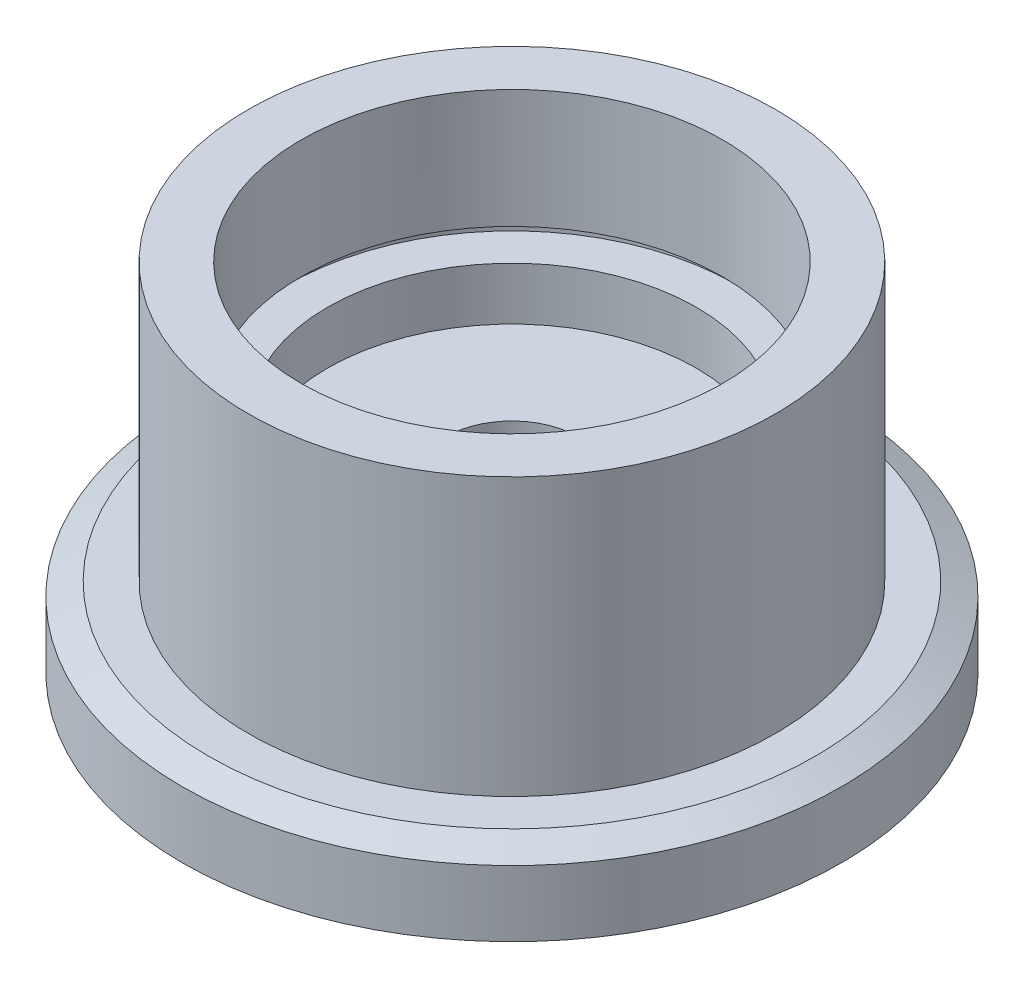
from build123d import *

# Parameters (mm, degrees)
ESQUISSE1_R             = 12.5
BOSS_EXTRU_1_DEPTH      = 3.5
ESQUISSE2_R             = 10
BOSS_EXTRU_2_DEPTH      = 10.5
ESQUISSE3_R             = 2.5
ENL_V_MAT_EXTRU_1_DEPTH = 7
ESQUISSE4_R             = 7
ENL_V_MAT_EXTRU_2_DEPTH = 2
ESQUISSE5_R             = 8.5
ENL_V_MAT_EXTRU_3_DEPTH = 0.5
ESQUISSE6_R             = 8
ENL_V_MAT_EXTRU_4_DEPTH = 5
CHANFREIN1_SIZE         = 0.5
CHANFREIN1_SIZE2        = 1
CHANFREIN2_SIZE         = 1
CHANFREIN2_SIZE2        = 0.5


with BuildPart() as part:
    # Esquisse1 → Boss.-Extru.1 (new body)
    with BuildSketch(Plane(origin=(0, 0, 0), x_dir=(1, 0, 0), z_dir=(0, 1, 0))):
        Circle(ESQUISSE1_R)
    extrude(amount=BOSS_EXTRU_1_DEPTH)

    # Esquisse2 → Boss.-Extru.2 (add)
    with BuildSketch(Plane(origin=(0, 3.5, 0), x_dir=(1, 0, 0), z_dir=(0, 1, 0))):
        Circle(ESQUISSE2_R)
    extrude(amount=BOSS_EXTRU_2_DEPTH)

    # Esquisse3 → Enlèv. mat.-Extru.1 (cut)
    with BuildSketch(Plane.XZ):
        Circle(ESQUISSE3_R)
    extrude(amount=-ENL_V_MAT_EXTRU_1_DEPTH, mode=Mode.SUBTRACT)

    # Esquisse4 → Enlèv. mat.-Extru.2 (cut)
    with BuildSketch(Plane.XZ.offset(-7)):
        Circle(ESQUISSE4_R)
    extrude(amount=-ENL_V_MAT_EXTRU_2_DEPTH, mode=Mode.SUBTRACT)

    # Esquisse5 → Enlèv. mat.-Extru.3 (cut)
    with BuildSketch(Plane.XZ.offset(-9)):
        Circle(ESQUISSE5_R)
    extrude(amount=-ENL_V_MAT_EXTRU_3_DEPTH, mode=Mode.SUBTRACT)

    # Esquisse6 → Enlèv. mat.-Extru.4 (cut)
    with BuildSketch(Plane(origin=(0, 14, 0), x_dir=(1, 0, 0), z_dir=(0, 1, 0))):
        Circle(ESQUISSE6_R)
    extrude(amount=-ENL_V_MAT_EXTRU_4_DEPTH, mode=Mode.SUBTRACT)

    # Chanfrein1
    chanfrein1_edges = [part.edges().sort_by_distance(p)[0] for p in [
        (-12.5, 3.5, 0),
    ]]
    chanfrein1_side = [part.faces().sort_by_distance(p)[0] for p in [
        (-12.5, 1.75, 0),
    ]]
    chamfer(chanfrein1_edges, length=CHANFREIN1_SIZE, length2=CHANFREIN1_SIZE2, reference=chanfrein1_side[0])

    # Chanfrein2
    chanfrein2_edges = [part.edges().sort_by_distance(p)[0] for p in [
        (-12.5, 0, 0),
    ]]
    chanfrein2_side = [part.faces().sort_by_distance(p)[0] for p in [
        (-12.146446609, 0, 0),
    ]]
    chamfer(chanfrein2_edges, length=CHANFREIN2_SIZE, length2=CHANFREIN2_SIZE2, reference=chanfrein2_side[0])


solid = part.part
